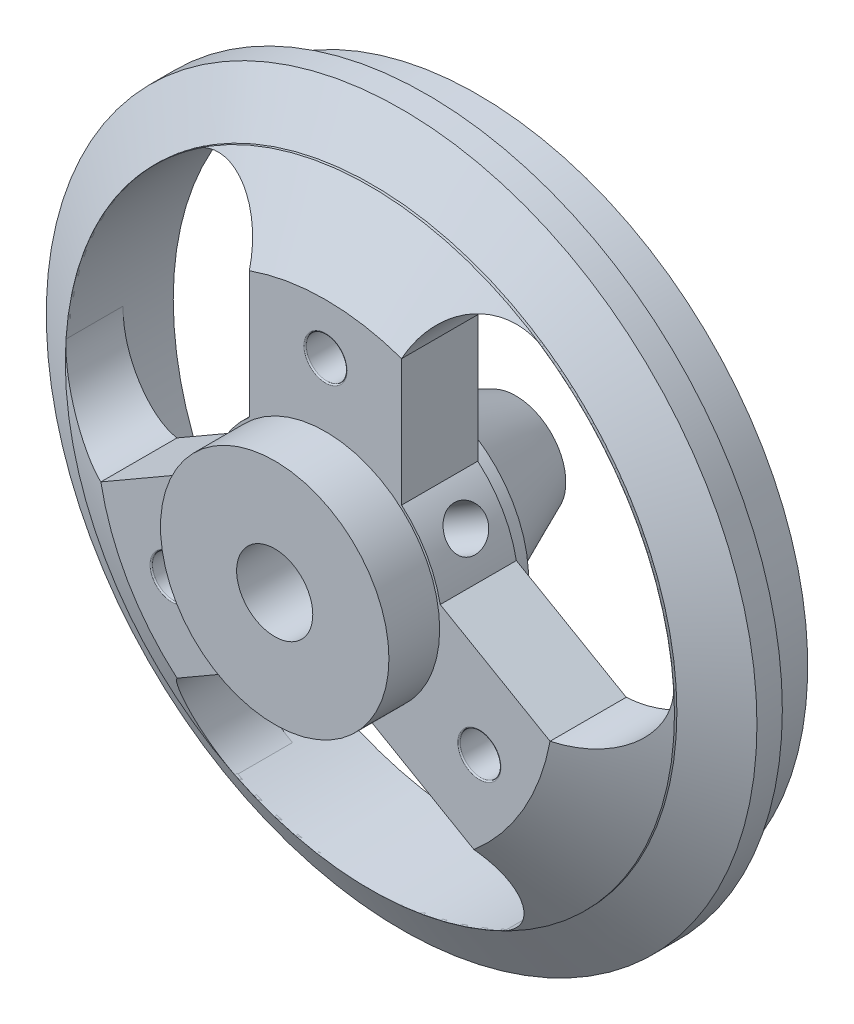
from build123d import *
from build123d.topology import SkipClean

# Parameters (mm, degrees)
SKETCH1_R                       = 14
BOSS_EXTRUDE1_DEPTH             = 4
SKETCH2_R                       = 1
CUT_EXTRUDE2_DEPTH              = 5
CUT_EXTRUDE4_DEPTH              = 5
SKETCH6_R                       = 4.5
BOSS_EXTRUDE2_DEPTH             = 2
SKETCH7_R                       = 13
SKETCH7_R_2                     = 11.997712714
BOSS_EXTRUDE3_DEPTH             = 2
CUT_EXTRUDE8_START              = -3
SKETCH9_R                       = 14
SKETCH9_R_2                     = 12
CUT_EXTRUDE8_DEPTH              = 3
CHAMFER2_SIZE                   = 2
CHAMFER2_SIZE_2                 = 1.154700538
CHAMFER6_SIZE                   = 1.75
CHAMFER6_SIZE_2                 = 3
SKETCH12_R                      = 1.5
CUT_EXTRUDE9_DEPTH              = 6
CUT_EXTRUDE11_START             = -1
SKETCH13_R                      = 11.997712714
CUT_EXTRUDE11_DEPTH             = 1
CHAMFER7_START                  = -1e-07
CHAMFER7_DEPTH                  = 1.0000001
CHAMFER7_START_2                = -2.0000001
CHAMFER7_3_DEPTH                = 3.0000001
BOSS_EXTRUDE5_START             = 0.5
SKETCH14_R                      = 4.5
BOSS_EXTRUDE5_DEPTH             = 0.5
SKETCH15_R                      = 3.75
BOSS_EXTRUDE7_DEPTH             = 4
CHAMFER9_SIZE                   = 4
CHAMFER9_SIZE_2                 = 1.780914741
CUT_EXTRUDE12_START             = -7
SKETCH18_R                      = 1.5
CUT_EXTRUDE12_DEPTH             = 7
BOSS_EXTRUDE8_DEPTH             = 0.01
BOSS_EXTRUDE8_DEPTH_BACK        = 3
SKETCH22_R                      = 1
BOSS_EXTRUDE9_DEPTH             = 0.01
BOSS_EXTRUDE9_DEPTH_BACK        = 3
SKETCH23_R                      = 1
BOSS_EXTRUDE10_DEPTH            = 0.01
BOSS_EXTRUDE10_DEPTH_BACK       = 3
SKETCH24_R                      = 1
TAP_DRILL_FOR_M2X0_4_TAP4_D     = 1.6
TAP_DRILL_FOR_M2X0_4_TAP4_DEPTH = 10
TAP_DRILL_FOR_M2X0_4_TAP4_TIP   = 0.480688495
FILLET1_R                       = 0.05
TAP_DRILL_FOR_M2X0_4_TAP6_D     = 1.6
TAP_DRILL_FOR_M2X0_4_TAP6_DEPTH = 4
TAP_DRILL_FOR_M2X0_4_TAP6_TIP   = 0.480688495


with BuildPart() as part:
    # Sketch1 → Boss-Extrude1 (new body)
    with BuildSketch(Plane.XY):
        Circle(SKETCH1_R)
    extrude(amount=BOSS_EXTRUDE1_DEPTH)

    # Sketch2 → Cut-Extrude2 (cut)
    with BuildSketch(Plane.XY.offset(4)):
        with Locations((0, 7)):
            Circle(SKETCH2_R)
        with Locations((6.062177826, -3.5)):
            Circle(SKETCH2_R)
        with Locations((-6.062177826, -3.5)):
            Circle(SKETCH2_R)
    extrude(amount=-CUT_EXTRUDE2_DEPTH, mode=Mode.SUBTRACT)

    # Sketch4 → Cut-Extrude4 (cut)
    with BuildSketch(Plane.XY.offset(4)):
        with BuildLine():
            Line((-3, 8.485281374), (-3, 3.487119155))
            ThreePointArc((-3, 3.487119155), (-3.983716857, 2.3), (-4.519933774, 0.854516634))
            Line((-4.519933774, 0.854516634), (-8.848469228, -1.644564476))
            ThreePointArc((-8.848469228, -1.644564476), (-11.010445776, -1.195792963), (-11.971534434, 0.792132351))
            ThreePointArc((-11.971534434, 0.792132351), (-10.390323998, 5.998856357), (-6.671773957, 9.971586766))
            ThreePointArc((-6.671773957, 9.971586766), (-4.469635805, 10.13322223), (-3, 8.485281374))
        make_face()
        with BuildLine():
            Line((8.848469228, -1.644564476), (4.519933774, 0.854516634))
            ThreePointArc((4.519933774, 0.854516634), (3.983716857, 2.3), (3, 3.487119155))
            Line((3, 3.487119155), (3, 8.485281374))
            ThreePointArc((3, 8.485281374), (4.469635805, 10.13322223), (6.671773956, 9.971586766))
            ThreePointArc((6.671773956, 9.971586766), (10.390323997, 5.998856357), (11.971534434, 0.792132352))
            ThreePointArc((11.971534434, 0.792132352), (11.010445776, -1.195792963), (8.848469228, -1.644564476))
        make_face()
        with BuildLine():
            Line((-5.848469228, -6.840716898), (-1.519933774, -4.341635789))
            ThreePointArc((-1.519933774, -4.341635789), (0, -4.6), (1.519933774, -4.341635789))
            Line((1.519933774, -4.341635789), (5.848469228, -6.840716898))
            ThreePointArc((5.848469228, -6.840716898), (6.540809971, -8.937429267), (5.299760478, -10.763719118))
            ThreePointArc((5.299760478, -10.763719118), (0, -11.997712714), (-5.299760477, -10.763719118))
            ThreePointArc((-5.299760477, -10.763719118), (-6.540809971, -8.937429268), (-5.848469228, -6.840716898))
        make_face()
    extrude(amount=-CUT_EXTRUDE4_DEPTH, mode=Mode.SUBTRACT)

    # Sketch6 → Boss-Extrude2 (add)
    with BuildSketch(Plane.XY.offset(4)):
        Circle(SKETCH6_R)
    extrude(amount=BOSS_EXTRUDE2_DEPTH)

    # Sketch7 → Boss-Extrude3 (add)
    with SkipClean():  # the faces are left unmerged after this step: merging them gives an invalid solid
        with BuildSketch(Plane(origin=(0, 0, 0), x_dir=(-1, 0, 0), z_dir=(0, 0, -1))):
            Circle(SKETCH7_R)
            with Locations(Location((0, 0, 0), (0, 0, 176.214371839))):
                Circle(SKETCH7_R_2, mode=Mode.SUBTRACT)
        extrude(amount=BOSS_EXTRUDE3_DEPTH)

    # Sketch9 → Cut-Extrude8 (cut)
    with BuildSketch(Plane.XY.offset(4).offset(CUT_EXTRUDE8_START)):
        Circle(SKETCH9_R)
        Circle(SKETCH9_R_2, mode=Mode.SUBTRACT)
    extrude(amount=CUT_EXTRUDE8_DEPTH, mode=Mode.SUBTRACT)

    # Chamfer2
    # the kernel refuses this chamfer: 2, 1.154700538 mm, written as the material it adds along each edge
    with BuildSketch(Plane(origin=(0, 0, 1), x_dir=(1, 0, 0), z_dir=(0, -1, 0))) as chamfer2_piece_1_section:
        Polygon((12 + CHAMFER2_SIZE, 0), (12, CHAMFER2_SIZE_2), (12, 0), align=None)
    chamfer2_piece_1 = revolve(axis=Axis((0, 0, 1), (0, 0, 1)), mode=Mode.PRIVATE)
    chamfer2_piece_1 = chamfer2_piece_1 & Plane(origin=(0, 0, 1), x_dir=(1, 0, 0), z_dir=(0, 0, -1)) * Cylinder(14, 56, mode=Mode.PRIVATE)
    add(chamfer2_piece_1)

    # Chamfer6
    # the kernel refuses this chamfer: 3, 1.75 mm, written as the material it takes off along each edge
    with BuildSketch(Plane(origin=(0, 0, 4), x_dir=(1, 0, 0), z_dir=(0, -1, 0))) as chamfer6_piece_1:
        Polygon((12, -CHAMFER6_SIZE), (12 - CHAMFER6_SIZE_2, 0), (12, 0), align=None)
    revolve(axis=Axis((0, 0, 4), (0, 0, 1)), mode=Mode.SUBTRACT)

    # Sketch12 → Cut-Extrude9 (cut)
    with SkipClean():  # the faces are left unmerged after this step: merging them gives an invalid solid
        with BuildSketch(Plane.XY.offset(6)):
            Circle(SKETCH12_R)
        extrude(amount=-CUT_EXTRUDE9_DEPTH, mode=Mode.SUBTRACT)

    # Sketch13 → Cut-Extrude11 (cut)
    with SkipClean():  # the faces are left unmerged after this step: merging them gives an invalid solid
        with BuildSketch(Plane(origin=(0, 0, 0), x_dir=(-1, 0, 0), z_dir=(0, 0, -1)).offset(CUT_EXTRUDE11_START)):
            with Locations(Location((0, 0, 0), (0, 0, 176.214371839))):
                Circle(SKETCH13_R)
        extrude(amount=CUT_EXTRUDE11_DEPTH, mode=Mode.SUBTRACT)

    # Chamfer7: read off the stored shape, not the designer's step
    # Chamfer7 outline → Chamfer7 (add)
    with BuildSketch(Plane.XY.offset(CHAMFER7_START)):
        with BuildLine():
            ThreePointArc((5.299760478, -10.763719118), (10.390323998, -5.998856357), (11.971534434, 0.792132352))
            ThreePointArc((11.971534434, 0.792132352), (10.390323997, 5.998856357), (6.671773956, 9.971586767))
            ThreePointArc((6.671773956, 9.971586767), (0, 11.997712714), (-6.671773957, 9.971586766))
            ThreePointArc((-6.671773957, 9.971586766), (-10.390323998, 5.998856357), (-11.971534434, 0.792132351))
            ThreePointArc((-11.971534434, 0.792132351), (-10.390323997, -5.998856357), (-5.299760477, -10.763719118))
            ThreePointArc((-5.299760477, -10.763719118), (0, -11.997712714), (5.299760478, -10.763719118))
        make_face()
    extrude(amount=CHAMFER7_DEPTH)

    # Chamfer7 2 outline → Chamfer7 2 (revolve, cut)
    with BuildSketch(Plane.XZ):
        Polygon((0, 0), (11.997712714, 0), (8.997712714, 1), (0, 1), align=None)
    revolve(axis=Axis((0, 0, 0), (0, 0, 1)), mode=Mode.SUBTRACT)

    # Chamfer7 3 outline → Chamfer7 3 (cut)
    with SkipClean():  # the faces are left unmerged after this step: merging them gives an invalid solid
        with BuildSketch(Plane.XY.offset(CHAMFER7_START_2)):
            with BuildLine():
                ThreePointArc((-11.971534434, 0.792132351), (-11.010445776, -1.195792963), (-8.848469228, -1.644564476))
                Line((-8.848469228, -1.644564476), (-1.204041756, 0.333705757))
                Line((-1.204041756, 0.333705757), (-2.025634145, 1.169500422))
                Line((-2.025634145, 1.169500422), (-0.891018539, 0.875877873))
                Line((-0.891018539, 0.875877873), (-3, 8.485281374))
                ThreePointArc((-3, 8.485281374), (-4.469635805, 10.13322223), (-6.671773957, 9.971586766))
                ThreePointArc((-6.671773957, 9.971586766), (-10.390323998, 5.998856357), (-11.971534434, 0.792132351))
            make_face()
            with BuildLine():
                ThreePointArc((-5.848469228, -6.840716898), (-6.540809971, -8.937429267), (-5.299760477, -10.763719118))
                ThreePointArc((-5.299760477, -10.763719118), (0, -11.997712714), (5.299760478, -10.763719118))
                ThreePointArc((5.299760478, -10.763719118), (6.540809971, -8.937429267), (5.848469228, -6.840716898))
                Line((5.848469228, -6.840716898), (0.313023217, -1.209583624))
                Line((0.313023217, -1.209583624), (1e-09, -2.339000836))
                Line((1e-09, -2.339000836), (-0.313023216, -1.209583625))
                Line((-0.313023216, -1.209583625), (-5.848469228, -6.840716898))
            make_face()
            with BuildLine():
                ThreePointArc((6.671773956, 9.971586766), (4.469635804, 10.13322223), (3, 8.485281374))
                Line((3, 8.485281374), (0.89101854, 0.875877873))
                Line((0.89101854, 0.875877873), (2.025634151, 1.169500423))
                Line((2.025634151, 1.169500423), (1.204041758, 0.333705756))
                Line((1.204041758, 0.333705756), (8.848469228, -1.644564476))
                ThreePointArc((8.848469228, -1.644564476), (11.010445776, -1.195792963), (11.971534434, 0.792132352))
                ThreePointArc((11.971534434, 0.792132352), (10.390323997, 5.998856357), (6.671773956, 9.971586766))
            make_face()
        extrude(amount=CHAMFER7_3_DEPTH, mode=Mode.SUBTRACT)

    # Sketch14 → Boss-Extrude5 (add)
    with SkipClean():  # the faces are left unmerged after this step: merging them gives an invalid solid
        with BuildSketch(Plane(origin=(0, 0, 1), x_dir=(-1, 0, 0), z_dir=(0, 0, -1)).offset(BOSS_EXTRUDE5_START)):
            with Locations(Location((0, 0, 0), (0, 0, 180))):
                Circle(SKETCH14_R)
        extrude(amount=-BOSS_EXTRUDE5_DEPTH)

    # Sketch15 → Boss-Extrude7 (add)
    with SkipClean():  # the faces are left unmerged after this step: merging them gives an invalid solid
        with BuildSketch(Plane(origin=(0, 0, 0.5), x_dir=(-1, 0, 0), z_dir=(0, 0, -1))):
            Circle(SKETCH15_R)
        extrude(amount=BOSS_EXTRUDE7_DEPTH)

    # Chamfer9
    # the kernel refuses this chamfer: 4, 1.780914741 mm, written as the material it takes off along each edge
    with BuildSketch(Plane(origin=(0, 0, -3.5), x_dir=(-1, 0, 0), z_dir=(0, -1, 0))) as chamfer9_piece_1_section:
        Polygon((3.75, -CHAMFER9_SIZE), (3.75 - CHAMFER9_SIZE_2, 0), (3.75, 0), align=None)
    chamfer9_piece_1 = revolve(axis=Axis((0, 0, -3.5), (0, 0, -1)), mode=Mode.PRIVATE)
    chamfer9_piece_1 = split(chamfer9_piece_1, bisect_by=Plane(origin=(0, 0, 0.5), z_dir=(0, 0, -1)), keep=Keep.TOP, mode=Mode.PRIVATE)
    add(chamfer9_piece_1, mode=Mode.SUBTRACT)

    # Sketch18 → Cut-Extrude12 (cut)
    with SkipClean():  # the faces are left unmerged after this step: merging them gives an invalid solid
        with BuildSketch(Plane(origin=(0, 0, -3.5), x_dir=(-1, 0, 0), z_dir=(0, 0, -1)).offset(CUT_EXTRUDE12_START)):
            with Locations(Location((0, 0, 0), (0, 0, 180))):
                Circle(SKETCH18_R)
        extrude(amount=CUT_EXTRUDE12_DEPTH, mode=Mode.SUBTRACT)

    # Sketch22 → Boss-Extrude8 (add, two sides: drawn at the far end of the back side and taken through both)
    with SkipClean():  # the faces are left unmerged after this step: merging them gives an invalid solid
        with BuildSketch(Plane(origin=(0, 0, 1), x_dir=(-1, 0, 0), z_dir=(0, 0, -1)).offset(-BOSS_EXTRUDE8_DEPTH_BACK)):
            with Locations((6.062177826, -3.5)):
                Circle(SKETCH22_R)
        extrude(amount=BOSS_EXTRUDE8_DEPTH + BOSS_EXTRUDE8_DEPTH_BACK)

    # Sketch23 → Boss-Extrude9 (add, two sides: drawn at the far end of the back side and taken through both)
    with SkipClean():  # the faces are left unmerged after this step: merging them gives an invalid solid
        with BuildSketch(Plane(origin=(0, 0, 1), x_dir=(-1, 0, 0), z_dir=(0, 0, -1)).offset(-BOSS_EXTRUDE9_DEPTH_BACK)):
            with Locations((0, 7)):
                Circle(SKETCH23_R)
        extrude(amount=BOSS_EXTRUDE9_DEPTH + BOSS_EXTRUDE9_DEPTH_BACK)

    # Sketch24 → Boss-Extrude10 (add, two sides: drawn at the far end of the back side and taken through both)
    with SkipClean():  # the faces are left unmerged after this step: merging them gives an invalid solid
        with BuildSketch(Plane(origin=(0, 0, 1), x_dir=(-1, 0, 0), z_dir=(0, 0, -1)).offset(-BOSS_EXTRUDE10_DEPTH_BACK)):
            with Locations((-6.062177826, -3.5)):
                Circle(SKETCH24_R)
        extrude(amount=BOSS_EXTRUDE10_DEPTH + BOSS_EXTRUDE10_DEPTH_BACK)

    # Tap Drill for M2x0.4 Tap4
    with Locations(Plane(origin=(0, 0, 0.99), x_dir=(-1, 0, 0), z_dir=(0, 0, -1))):
        with Locations((0, 7), (6.062177826, -3.5), (-6.062177826, -3.5)):
            Hole(TAP_DRILL_FOR_M2X0_4_TAP4_D / 2, depth=TAP_DRILL_FOR_M2X0_4_TAP4_DEPTH)
            with Locations((0, 0, -(TAP_DRILL_FOR_M2X0_4_TAP4_DEPTH + TAP_DRILL_FOR_M2X0_4_TAP4_TIP / 2))):  # 118° drill point
                Cone(0, TAP_DRILL_FOR_M2X0_4_TAP4_D / 2, TAP_DRILL_FOR_M2X0_4_TAP4_TIP, mode=Mode.SUBTRACT)

    # Fillet1
    fillet1_edges = [part.edges().sort_by_distance(p)[0] for p in [
        (5.262177826, -3.5, 4),
        (5.262177826, -3.5, 0.99),
        (-6.862177826, -3.5, 4),
        (-6.862177826, -3.5, 0.99),
        (-0.8, 7, 4),
        (-0.8, 7, 0.99),
    ]]
    fillet(fillet1_edges, radius=FILLET1_R)

    # Tap Drill for M2x0.4 Tap6
    with Locations(Plane(origin=(3.946615568, 2.363096604, 2.401970743), x_dir=(-0.513716653023, 0.85795990606, 0), z_dir=(0.85795990606, 0.513716653023, 0))):
        with Locations((0, 0)):
            Hole(TAP_DRILL_FOR_M2X0_4_TAP6_D / 2, depth=TAP_DRILL_FOR_M2X0_4_TAP6_DEPTH)
            with Locations((0, 0, -(TAP_DRILL_FOR_M2X0_4_TAP6_DEPTH + TAP_DRILL_FOR_M2X0_4_TAP6_TIP / 2))):  # 118° drill point
                Cone(0, TAP_DRILL_FOR_M2X0_4_TAP6_D / 2, TAP_DRILL_FOR_M2X0_4_TAP6_TIP, mode=Mode.SUBTRACT)


solid = part.part
